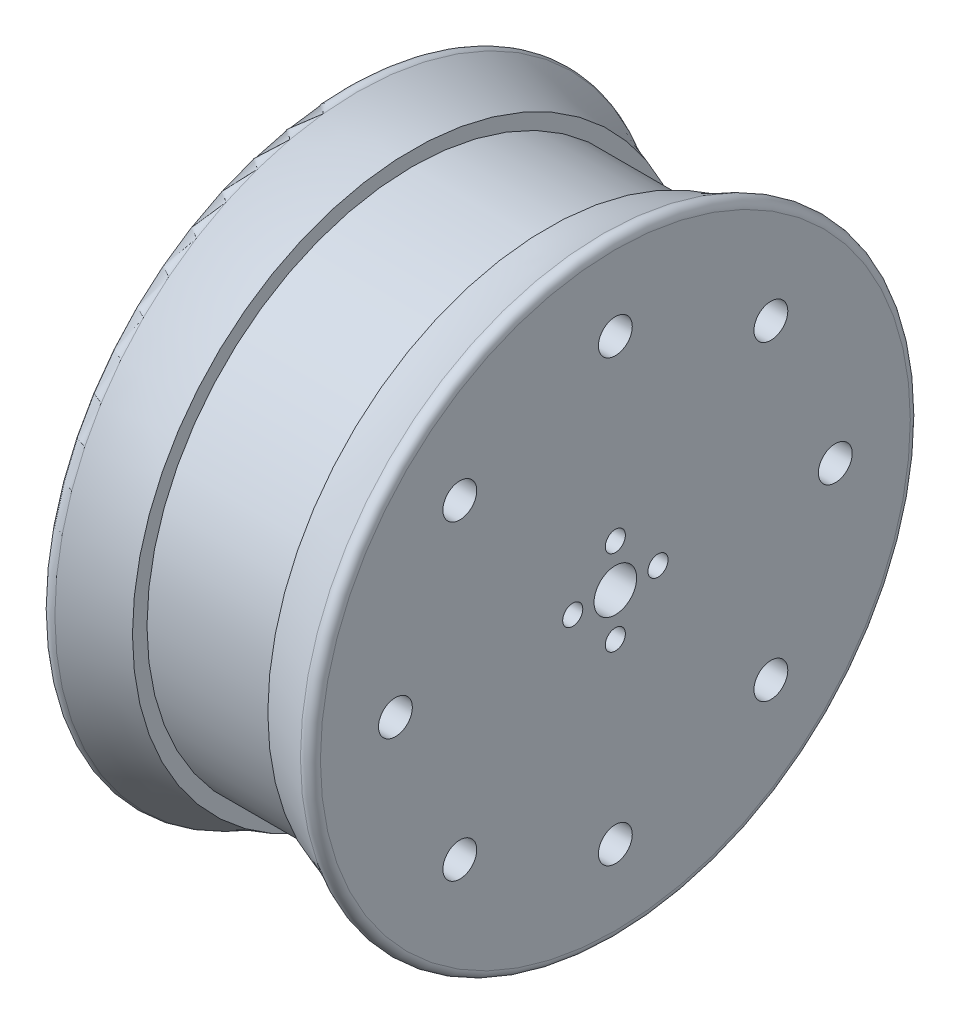
from build123d import *

# Parameters (mm, degrees)
FLOWER_R               = 4
FLOWER_R_2             = 1.885
MOUNTING_DEPTH         = 97.64818827
FILLET1_R              = 1.5875
SKETCH1_R              = 3.175
MASS_AND_BALANCE_DEPTH = 96.215749642


with BuildPart() as part:
    # Wheel Arc → Wheel (revolve)
    with BuildSketch(Plane.XY):
        with BuildLine():
            Line((-25.4, 0), (25.4, 0))
            Line((25.4, 0), (25.4, -58.138766309))
            ThreePointArc((25.4, -58.138766309), (19.25570916, -54.8663236), (12.7, -52.524557464))
            Line((12.7, -52.524557464), (12.7, -49.8))
            Line((12.7, -49.8), (-12.7, -49.8))
            Line((-12.7, -49.8), (-12.7, -52.524557464))
            ThreePointArc((-12.7, -52.524557464), (-19.25570916, -54.8663236), (-25.4, -58.138766309))
            Line((-25.4, -58.138766309), (-25.4, 0))
        make_face()
    revolve(axis=Axis((-40.905271883, 0, 0), (1, 0, 0)))

    # Flower → Mounting (cut, through all)
    with BuildSketch(Plane(origin=(25.4, 0, 0), x_dir=(0, 0, -1), z_dir=(1, 0, 0))):
        Circle(FLOWER_R)
        with Locations((0, 8)):
            Circle(FLOWER_R_2)
        with Locations((8, 0)):
            Circle(FLOWER_R_2)
        with Locations((0, -8)):
            Circle(FLOWER_R_2)
        with Locations((-8, 0)):
            Circle(FLOWER_R_2)
    extrude(amount=-MOUNTING_DEPTH, mode=Mode.SUBTRACT)

    # Fillet1
    fillet1_edges = [part.edges().sort_by_distance(p)[0] for p in [
        (25.4, 58.138766309, 0),
        (-25.4, 58.138766309, 0),
    ]]
    fillet(fillet1_edges, radius=FILLET1_R)

    # Sketch1 → Mass_and_Balance (cut, through all)
    with BuildSketch(Plane(origin=(25.4, 0, 0), x_dir=(0, 0, -1), z_dir=(1, 0, 0))):
        with Locations((0, 41.275)):
            Circle(SKETCH1_R)
        with Locations((29.185832393, 29.185832393)):
            Circle(SKETCH1_R)
        with Locations((41.275, 0)):
            Circle(SKETCH1_R)
        with Locations((29.185832393, -29.185832393)):
            Circle(SKETCH1_R)
        with Locations((0, -41.275)):
            Circle(SKETCH1_R)
        with Locations((-29.185832393, -29.185832393)):
            Circle(SKETCH1_R)
        with Locations((-41.275, 0)):
            Circle(SKETCH1_R)
        with Locations((-29.185832393, 29.185832393)):
            Circle(SKETCH1_R)
    extrude(amount=-MASS_AND_BALANCE_DEPTH, mode=Mode.SUBTRACT)


solid = part.part
